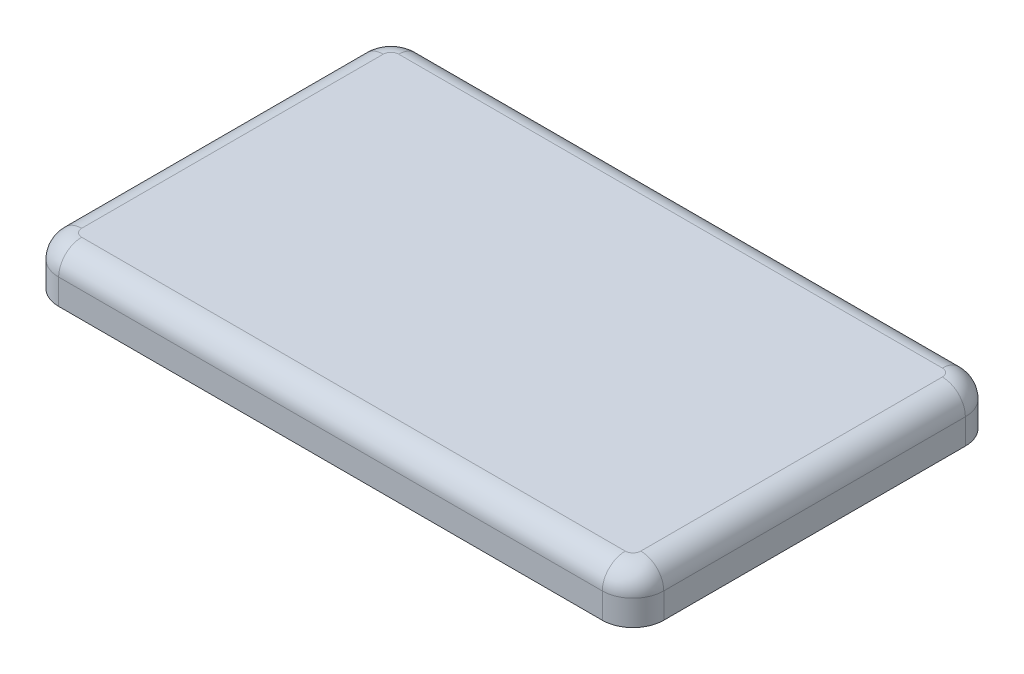
from build123d import *

# Parameters (mm, degrees)
SKETCH1_W           = 250
SKETCH1_H           = 150
BOSS_EXTRUDE1_DEPTH = 20
FILLET1_R           = 12.7
FILLET2_R           = 9.5


with BuildPart() as part:
    # Sketch1 → Boss-Extrude1 (new body)
    with BuildSketch(Plane(origin=(0, 0, 0), x_dir=(1, 0, 0), z_dir=(0, 1, 0))):
        Rectangle(SKETCH1_W, SKETCH1_H)
    extrude(amount=-BOSS_EXTRUDE1_DEPTH)

    # Fillet1
    fillet1_edges = [part.edges().sort_by_distance(p)[0] for p in [
        (-125, -10, -75),
        (125, -10, -75),
        (-125, -10, 75),
        (125, -10, 75),
    ]]
    fillet(fillet1_edges, radius=FILLET1_R)

    # Fillet2
    fillet2_edges = [part.edges().sort_by_distance(p)[0] for p in [
        (-121.280256121, 0, 71.280256121),
        (-125, 0, 0),
        (-121.280256121, 0, -71.280256121),
        (0, 0, -75),
        (121.280256121, 0, -71.280256121),
        (125, 0, 0),
        (121.280256121, 0, 71.280256121),
        (0, 0, 75),
    ]]
    fillet(fillet2_edges, radius=FILLET2_R)


solid = part.part
